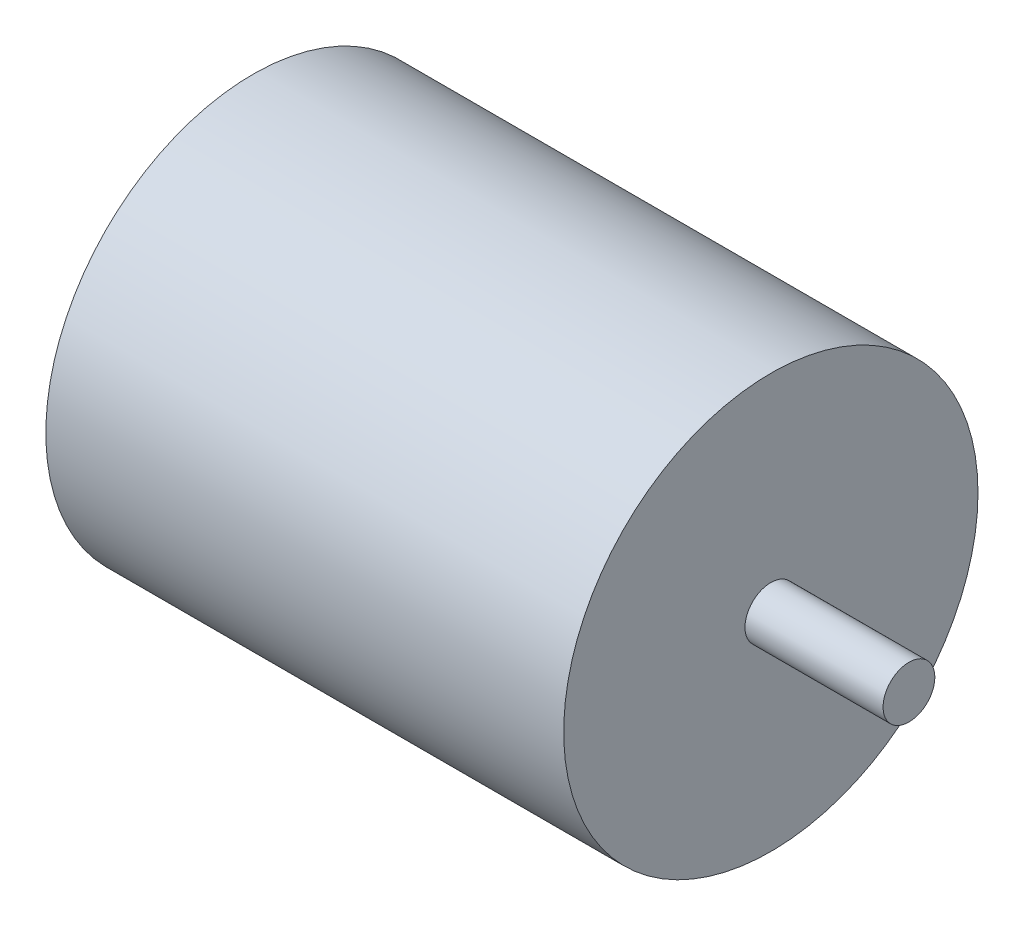
from build123d import *

# Parameters (mm, degrees)
SKETCH_1_R      = 12
EXTRUDE_1_DEPTH = 30
SKETCH_2_R      = 1.5
EXTRUDE_2_DEPTH = 8


with BuildPart() as part:
    # 草图1 → 凸台-拉伸1 (new body)
    with BuildSketch(Plane(origin=(0, 0, 0), x_dir=(0, 0, -1), z_dir=(1, 0, 0))):
        Circle(SKETCH_1_R)
    extrude(amount=EXTRUDE_1_DEPTH)

    # 草图2 → 凸台-拉伸2 (add)
    with BuildSketch(Plane(origin=(30, 0, 0), x_dir=(0, 0, -1), z_dir=(1, 0, 0))):
        Circle(SKETCH_2_R)
    extrude(amount=EXTRUDE_2_DEPTH)


solid = part.part
